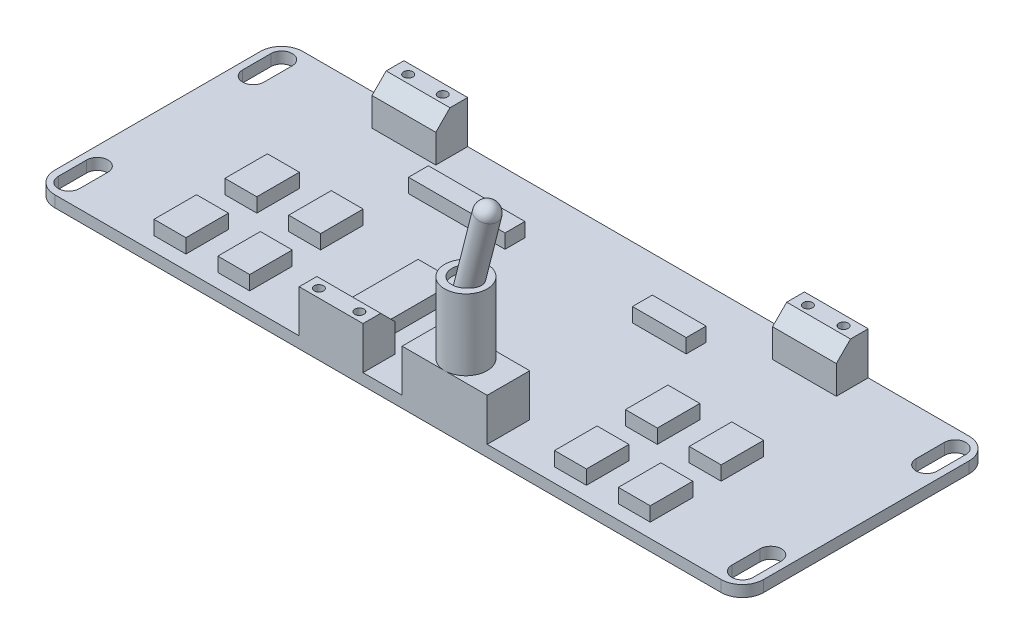
from build123d import *

# Parameters (mm, degrees)
SKETCH_1_W          = 100
SKETCH_1_H          = 35
EXTRUDE_1_DEPTH     = 1.6
CUT_EXTRUDE_1_DEPTH = 53.998207517
FILLET_1_R          = 3
SKETCH_3_W          = 12
SKETCH_3_H          = 6
EXTRUDE_2_DEPTH     = 6
SKETCH_4_R          = 3
EXTRUDE_3_DEPTH     = 10
SKETCH_5_W          = 4.5
SKETCH_5_H          = 6
SKETCH_5_W_2        = 5.403478788
SKETCH_5_H_2        = 11.06674021
EXTRUDE_4_DEPTH     = 2
SKETCH_6_W          = 7.585652914
SKETCH_6_H          = 2.805652448
SKETCH_6_W_2        = 13.612610022
EXTRUDE_5_DEPTH     = 2
SKETCH_7_W          = 9
SKETCH_7_H          = 4.5
EXTRUDE_6_DEPTH     = 6
CHAMFER_1_SIZE      = 2
SKETCH_9_R          = 0.65
CUT_EXTRUDE_2_DEPTH = 1
SWEEP_1_PROFILE_R   = 1.5
SKETCH_27_R         = 1.993301653
CUT_EXTRUDE_3_DEPTH = 1


with BuildPart() as part:
    # 草图1 → 凸台-拉伸1 (new body)
    with BuildSketch(Plane(origin=(0, 0, 0), x_dir=(1, 0, 0), z_dir=(0, 1, 0))):
        Rectangle(SKETCH_1_W, SKETCH_1_H)
    extrude(amount=EXTRUDE_1_DEPTH)

    # 草图2 → 切除-拉伸1 (cut, through all)
    with BuildSketch(Plane(origin=(0, 1.6, 0), x_dir=(1, 0, 0), z_dir=(0, 1, 0))):
        with BuildLine():
            Line((-49, 11), (-49, 15))
            ThreePointArc((-49, 15), (-47.5, 16.5), (-46, 15))
            Line((-46, 15), (-46, 11))
            ThreePointArc((-46, 11), (-47.5, 9.5), (-49, 11))
        make_face()
        with BuildLine():
            Line((49, 11), (49, 15))
            ThreePointArc((49, 15), (47.5, 16.5), (46, 15))
            Line((46, 15), (46, 11))
            ThreePointArc((46, 11), (47.5, 9.5), (49, 11))
        make_face()
        with BuildLine():
            Line((-49, -11), (-49, -15))
            ThreePointArc((-49, -15), (-47.5, -16.5), (-46, -15))
            Line((-46, -15), (-46, -11))
            ThreePointArc((-46, -11), (-47.5, -9.5), (-49, -11))
        make_face()
        with BuildLine():
            Line((49, -11), (49, -15))
            ThreePointArc((49, -15), (47.5, -16.5), (46, -15))
            Line((46, -15), (46, -11))
            ThreePointArc((46, -11), (47.5, -9.5), (49, -11))
        make_face()
    extrude(amount=-CUT_EXTRUDE_1_DEPTH, mode=Mode.SUBTRACT)

    # 圆角1
    fillet_1_edges = [part.edges().sort_by_distance(p)[0] for p in [
        (50, 0.8, 17.5),
        (-50, 0.8, 17.5),
        (-50, 0.8, -17.5),
        (50, 0.8, -17.5),
    ]]
    fillet(fillet_1_edges, radius=FILLET_1_R)

    # 草图3 → 凸台-拉伸2 (add)
    with BuildSketch(Plane(origin=(0, 1.6, 0), x_dir=(1, 0, 0), z_dir=(0, 1, 0))):
        with Locations((8, -14.5)):
            Rectangle(SKETCH_3_W, SKETCH_3_H)
    extrude(amount=EXTRUDE_2_DEPTH)

    # 草图4 → 凸台-拉伸3 (add)
    with BuildSketch(Plane(origin=(0, 7.6, 0), x_dir=(1, 0, 0), z_dir=(0, 1, 0))):
        with Locations(Location((8, -14.5, 0), (0, 0, 270))):
            Circle(SKETCH_4_R)
    extrude(amount=EXTRUDE_3_DEPTH)

    # 草图5 → 凸台-拉伸4 (add)
    with BuildSketch(Plane(origin=(0, 1.6, 0), x_dir=(1, 0, 0), z_dir=(0, 1, 0))):
        with Locations((-32.75, -2.5)):
            Rectangle(SKETCH_5_W, SKETCH_5_H)
        with Locations((-23.75, -2.5)):
            Rectangle(SKETCH_5_W, SKETCH_5_H)
        with Locations((-32.75, -12.5)):
            Rectangle(SKETCH_5_W, SKETCH_5_H)
        with Locations((-23.75, -12.5)):
            Rectangle(SKETCH_5_W, SKETCH_5_H)
        with Locations((-8.78065303, -7.299892016)):
            Rectangle(SKETCH_5_W_2, SKETCH_5_H_2)
        with Locations((23.75, -12.5)):
            Rectangle(SKETCH_5_W, SKETCH_5_H)
        with Locations((32.75, -12.5)):
            Rectangle(SKETCH_5_W, SKETCH_5_H)
        with Locations((32.75, -2.5)):
            Rectangle(SKETCH_5_W, SKETCH_5_H)
        with Locations((23.75, -2.5)):
            Rectangle(SKETCH_5_W, SKETCH_5_H)
    extrude(amount=EXTRUDE_4_DEPTH)

    # 草图6 → 凸台-拉伸5 (add)
    with BuildSketch(Plane(origin=(0, 1.6, 0), x_dir=(1, 0, 0), z_dir=(0, 1, 0))):
        with Locations((13.196957808, 8.988479137)):
            Rectangle(SKETCH_6_W, SKETCH_6_H)
        with Locations((-15.379131934, 8.988479137)):
            Rectangle(SKETCH_6_W_2, SKETCH_6_H)
    extrude(amount=EXTRUDE_5_DEPTH)

    # 草图7 → 凸台-拉伸6 (add)
    with BuildSketch(Plane(origin=(0, 1.6, 0), x_dir=(1, 0, 0), z_dir=(0, 1, 0))):
        with Locations((-28.25, 15.25)):
            Rectangle(SKETCH_7_W, SKETCH_7_H)
        with Locations((28.25, 15.25)):
            Rectangle(SKETCH_7_W, SKETCH_7_H)
        with Locations((-8.02152296, -15.25)):
            Rectangle(SKETCH_7_W, SKETCH_7_H)
    extrude(amount=EXTRUDE_6_DEPTH)

    # 倒角1
    chamfer_1_edges = [part.edges().sort_by_distance(p)[0] for p in [
        (-28.25, 7.6, -13),
        (28.25, 7.6, -13),
        (-8.02152296, 7.6, 13),
    ]]
    chamfer(chamfer_1_edges, length=CHAMFER_1_SIZE)

    # 草图9 → 切除-拉伸2 (cut)
    with BuildSketch(Plane(origin=(0, 7.6, 0), x_dir=(1, 0, 0), z_dir=(0, 1, 0))):
        with Locations(Location((-30.77012682, 16.126476079, 0), (0, 0, 270))):
            Circle(SKETCH_9_R)
        with Locations(Location((-25.898686841, 16.126476079, 0), (0, 0, 270))):
            Circle(SKETCH_9_R)
        with Locations(Location((25.614567714, 16.126476079, 0), (0, 0, 270))):
            Circle(SKETCH_9_R)
        with Locations(Location((30.638295355, 16.126476079, 0), (0, 0, 270))):
            Circle(SKETCH_9_R)
        with Locations(Location((-10.92906004, -16.309333864, 0), (0, 0, 270))):
            Circle(SKETCH_9_R)
        with Locations(Location((-5.225111254, -16.309333864, 0), (0, 0, 270))):
            Circle(SKETCH_9_R)
    extrude(amount=-CUT_EXTRUDE_2_DEPTH, mode=Mode.SUBTRACT)

    # 草图27 → 切除-拉伸3 (cut)
    with BuildSketch(Plane(origin=(0, 17.6, 0), x_dir=(1, 0, 0), z_dir=(0, 1, 0))):
        with Locations(Location((8, -14.5, 0), (0, 0, 270))):
            Circle(SKETCH_27_R)
    extrude(amount=-CUT_EXTRUDE_3_DEPTH, mode=Mode.SUBTRACT)


with BuildPart() as body_2:
    # 扫描1: sweep along a path in 草图10
    with BuildLine(Plane.XY.offset(14.5)) as sweep_1_path:
        Line((7.943335964, 14.862681463), (11, 26.862681463))
    # 扫描1 profile (on start of the path) → 扫描1 (sweep)
    with BuildSketch(Plane(origin=(7.943335964, 14.862681463, 14.5), x_dir=(0.9690562615876172, -0.24683995194828523, 0), z_dir=(0.24683995194828523, 0.9690562615876172, 0))):
        Circle(SWEEP_1_PROFILE_R)
    sweep(path=sweep_1_path.line)

    # 圆顶1: read off the stored shape, not the designer's step
    # 圆顶1 outline → 圆顶1 (revolve)
    with BuildSketch(Plane(origin=(3.904168632, -0.994477654, 14.5), x_dir=(0.9690562615876172, -0.2468399519482851, 0), z_dir=(0, 0, 1))):
        with BuildLine():
            Line((0, 28.746689146), (1.5, 28.746689145))
            ThreePointArc((1.5, 28.746689145), (1.060660172, 29.807349317), (0, 30.246689146))
            Line((0, 30.246689146), (0, 28.746689146))
        make_face()
    revolve(axis=Axis((3.904168632, -0.994477654, 14.5), (0.2468399519482851, 0.9690562615876172, 0)))


with BuildPart() as part_1:
    add(part.part)

    # 相交1: read off the stored shape, not the designer's step
    # 相交1: union body 2
    add(body_2.part)


solid = part_1.part
